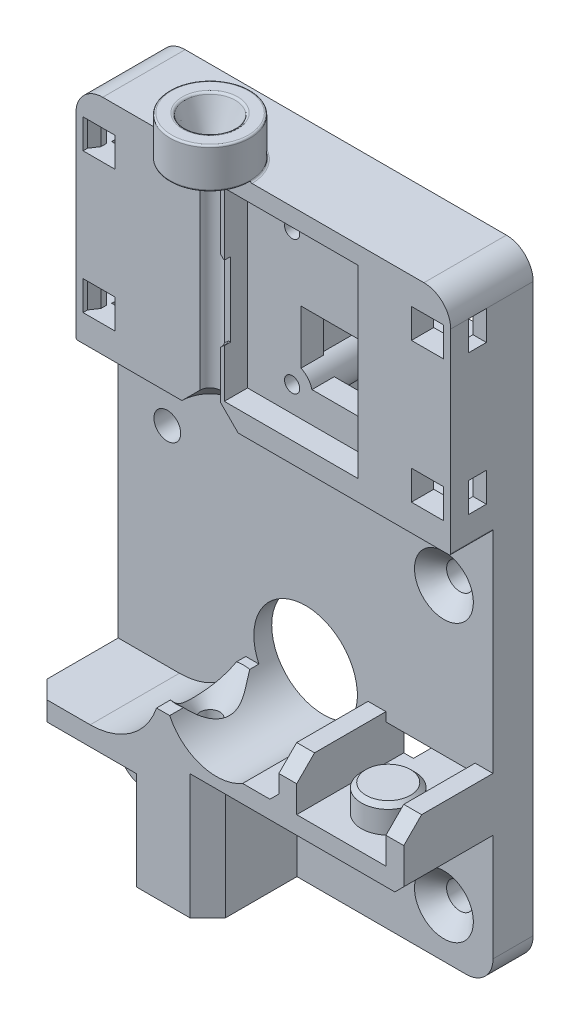
from build123d import *

# Parameters (mm, degrees)
SKETCH_26_R               = 5.8
SKETCH_26_R_2             = 1.5
EXTRUDE_8_DEPTH           = 4.5
EXTRUDE_9_DEPTH           = 10
SKETCH_29_R               = 11.25
CUT_EXTRUDE_1_DEPTH       = 2.5
CHAMFER_2_SIZE            = 0.8
CHAMFER_2_SIZE2           = 0.5
SKETCH_55_W               = 21.97
SKETCH_55_H               = 3
CUT_EXTRUDE_9_DEPTH       = 10
CHAMFER_3_SIZE            = 2
CHAMFER_START             = 4.5
CHAMFER_4_DEPTH           = 10.5
CHAMFER_START_2           = 4
CHAMFER_4_2_DEPTH         = 10.5
HOLE_WIZARD_M6_1_D        = 5
HOLE_WIZARD_M6_1_DEPTH    = 5.5
HOLE_WIZARD_1_D           = 3
HOLE_WIZARD_1_CSINK_D     = 6.6
HOLE_WIZARD_1_CSINK_ANGLE = 90
EXTRUDE_10_DEPTH          = 4.74
CUT_EXTRUDE_3_REACH       = 76.037
SKETCH_43_R               = 1.15
SKETCH_44_W               = 15
SKETCH_44_H               = 20.7
CUT_EXTRUDE_4_DEPTH       = 2.6
CUT_EXTRUDE_5_REACH       = 55.432
SKETCH_46_W               = 9
SKETCH_46_H               = 7.5
FILLET_4_R                = 0.2
CUT_EXTRUDE_8_REACH       = 56.804
SKETCH_53_W               = 10
SKETCH_53_H               = 4
SKETCH_54_R               = 3
CUT_EXTRUDE_10_DEPTH      = 2
SKETCH_56_W               = 1
SKETCH_56_H               = 8.3
CUT_EXTRUDE_11_DEPTH      = 0.7
SKETCH_45_R               = 2.3
EXTRUDE_13_DEPTH          = 6.64
CUT_EXTRUDE_12_REACH      = 56.804
SKETCH_57_R               = 0.85
SKETCH_61_R               = 2
CUT_EXTRUDE_13_DEPTH      = 10
CHAMFER_5_SIZE            = 0.5
FILLET_6_R                = 0.3
CHAMFER_6_SIZE            = 0.4
CHAMFER_8_SIZE            = 2
CUT_EXTRUDE_17_DEPTH      = 4.14
CUT_EXTRUDE_18_DEPTH      = 2.6
SKETCH_65_W               = 2
SKETCH_65_H               = 3.3
CUT_EXTRUDE_19_DEPTH      = 1.5
SKETCH_68_W               = 3
SKETCH_68_H               = 3.3
CUT_EXTRUDE_20_DEPTH      = 3
EXTRUDE_START             = 4.14
SKETCH_66_R               = 2.3
SKETCH_66_R_2             = 0.85
EXTRUDE_14_DEPTH          = 4.14
RIB_START                 = -6.6400001
RIB_1_DEPTH               = 6.6400001
RIB_START_2               = -8
RIB_1_2_OUTLINE_W         = 7.37
RIB_1_2_OUTLINE_H         = 1.5
RIB_1_2_OUTLINE_W_2       = 11.93
RIB_1_2_DEPTH             = 1.9155324
FILLET_7_R                = 0.2
FILLET_8_R                = 0.2
SKETCH_72_W               = 0.6
SKETCH_72_H               = 3.3
CUT_EXTRUDE_22_DEPTH      = 0.5
CUT_EXTRUDE_21_DEPTH      = 3.3
PATTERN_LINEAR_1_COUNT    = 2
PATTERN_LINEAR_1_PITCH    = 15.7


with BuildPart() as part:
    # 草图26 → 凸台-拉伸8 (new body)
    with BuildSketch(Plane.XY):
        with BuildLine():
            Line((-18, -21), (18, -21))
            ThreePointArc((18, -21), (20.121320344, -20.121320344), (21, -18))
            Line((21, -18), (21, 45.5))
            ThreePointArc((21, 45.5), (20.121320344, 47.621320344), (18, 48.5))
            Line((18, 48.5), (-18, 48.5))
            ThreePointArc((-18, 48.5), (-20.121320344, 47.621320344), (-21, 45.5))
            Line((-21, 45.5), (-21, -18))
            ThreePointArc((-21, -18), (-20.121320344, -20.121320344), (-18, -21))
        make_face()
        Circle(SKETCH_26_R, mode=Mode.SUBTRACT)
        with Locations((-15.5, 15.5)):
            Circle(SKETCH_26_R_2, mode=Mode.SUBTRACT)
        with Locations((15.5, 15.5)):
            Circle(SKETCH_26_R_2, mode=Mode.SUBTRACT)
        with Locations(Location((15.5, -15.5, 0), (0, 0, 180))):
            Circle(SKETCH_26_R_2, mode=Mode.SUBTRACT)
        with Locations(Location((-15.5, -15.5, 0), (0, 0, 180))):
            Circle(SKETCH_26_R_2, mode=Mode.SUBTRACT)
    extrude(amount=EXTRUDE_8_DEPTH)

    # 草图28 → 凸台-拉伸9 (add)
    with BuildSketch(Plane.XY.offset(4.5)):
        with BuildLine():
            Line((-21, -10), (-10.97, -10))
            Line((-10.97, -10), (-10.97, -21))
            Line((-10.97, -21), (-0.97, -21))
            Line((-0.97, -21), (-0.97, -10))
            Line((-0.97, -10), (21, -10))
            Line((21, -10), (21, 0))
            Line((21, 0), (19, 0))
            Line((19, 0), (19, -5))
            Line((19, -5), (9, -5))
            Line((9, -5), (9, 0))
            Line((9, 0), (7, 0))
            Line((7, 0), (7, -5))
            Line((7, -5), (2.939387691, -5))
            ThreePointArc((2.939387691, -5), (-1.696552439, -5.546323992), (-5.233545643, -2.5))
            Line((-5.233545643, -2.5), (-6.706454357, -2.5))
            ThreePointArc((-6.706454357, -2.5), (-9.56497696, -6.373019283), (-14.146753447, -7.849079599))
            Line((-14.146753447, -7.849079599), (-21, -7.849079599))
            Line((-21, -7.849079599), (-21, -10))
        make_face()
    extrude(amount=EXTRUDE_9_DEPTH)

    # 草图29 → 切除-拉伸1 (cut)
    with BuildSketch(Plane(origin=(0, 0, 0), x_dir=(-1, 0, 0), z_dir=(0, 0, -1))):
        Circle(SKETCH_29_R)
    extrude(amount=-CUT_EXTRUDE_1_DEPTH, mode=Mode.SUBTRACT)

    # 倒角2
    chamfer_2_edges = [part.edges().sort_by_distance(p)[0] for p in [
        (11.25, 0, 0),
    ]]
    chamfer_2_side = [part.faces().sort_by_distance(p)[0] for p in [
        (0, 16.106118952, 0),
    ]]
    chamfer(chamfer_2_edges, length=CHAMFER_2_SIZE, length2=CHAMFER_2_SIZE2, reference=chamfer_2_side[0])

    # 草图30 → 切除-旋转1 (revolve, cut)
    with BuildSketch(Plane.XY.offset(9.24)):
        Polygon((-5.97, -2.5), (-2.190437378, -2.5), (-4.87, -5.693378381), (-4.87, -22.266274107), (-5.97, -22.266274107), align=None)
    revolve(axis=Axis((-5.97, -25.234849808, 9.24), (0, 1, 0)), mode=Mode.SUBTRACT)

    # 草图34 → 旋转1 (revolve)
    with BuildSketch(Plane.XY.offset(9.24)):
        Polygon((16.5, -2), (17, -2.5), (17, -5), (14, -5), (14, -2), align=None)
    revolve(axis=Axis((14, -23.38223113, 9.24), (0, 1, 0)))

    # 草图55 → 切除-拉伸9 (cut)
    with BuildSketch(Plane.XY.offset(14.5)):
        with Locations((10.015, -8.5)):
            Rectangle(SKETCH_55_W, SKETCH_55_H)
    extrude(amount=-CUT_EXTRUDE_9_DEPTH, mode=Mode.SUBTRACT)

    # 倒角3
    chamfer_3_edges = [part.edges().sort_by_distance(p)[0] for p in [
        (20, 0, 14.5),
        (8, 0, 14.5),
        (-0.97, -14, 14.5),
        (-10.97, -15.5, 14.5),
        (-21, -8.9245398, 14.5),
    ]]
    chamfer(chamfer_3_edges, length=CHAMFER_3_SIZE)

    # 倒角4: read off the stored shape, not the designer's step
    # 倒角4 outline → 倒角4 (cut)
    with BuildSketch(Plane.XY.offset(CHAMFER_START)):
        Polygon((21, -7), (21, -6), (20, -7), align=None)
    extrude(amount=CHAMFER_4_DEPTH, mode=Mode.SUBTRACT)

    # Chamfer 4 2 outline → Chamfer 4 2 (add)
    with BuildSketch(Plane.XY.offset(CHAMFER_START_2)):
        Polygon((7, -5), (7, -4), (6, -5), align=None)
    extrude(amount=CHAMFER_4_2_DEPTH)

    # M6 螺纹孔1
    with Locations(Plane(origin=(0, -21, 0), x_dir=(-1, 0, 0), z_dir=(0, -1, 0))):
        with Locations((5.97, -9.24)):
            Hole(HOLE_WIZARD_M6_1_D / 2, depth=HOLE_WIZARD_M6_1_DEPTH)

    # 打孔尺寸(%根据十字)槽沉头木螺钉的类型1 (through all)
    with Locations(Plane.XY.offset(4.5)):
        with Locations((15.5, 15.5), (-15.5, -15.5), (15.5, -15.5)):
            CounterSinkHole(HOLE_WIZARD_1_D / 2, HOLE_WIZARD_1_CSINK_D / 2, counter_sink_angle=HOLE_WIZARD_1_CSINK_ANGLE)

    # 草图42 → 凸台-拉伸10 (add)
    with BuildSketch(Plane.XY.offset(4.5)):
        with BuildLine():
            Line((-21, 23.5), (21, 23.5))
            Line((21, 23.5), (21, 45.5))
            ThreePointArc((21, 45.5), (20.121320344, 47.621320344), (18, 48.5))
            Line((18, 48.5), (-18, 48.5))
            ThreePointArc((-18, 48.5), (-20.121320344, 47.621320344), (-21, 45.5))
            Line((-21, 45.5), (-21, 23.5))
        make_face()
    extrude(amount=EXTRUDE_10_DEPTH)

    # 草图43 → 切除-拉伸3 (cut, up to next)
    with BuildSketch(Plane(origin=(0, 48.5, 0), x_dir=(1, 0, 0), z_dir=(0, 1, 0)), mode=Mode.PRIVATE) as cut_extrude_3_sk1:
        with Locations((-5.97, -9.24)):
            Circle(SKETCH_43_R)
    cut_extrude_3_tool1 = extrude(cut_extrude_3_sk1.sketch, amount=-CUT_EXTRUDE_3_REACH, mode=Mode.PRIVATE) & part.part
    add(cut_extrude_3_tool1.solids().sort_by_distance((-5.97, 48.5, 9.24))[0], mode=Mode.SUBTRACT)

    # 草图44 → 切除-拉伸4 (cut)
    with BuildSketch(Plane.XY.offset(9.24)):
        with Locations((3.13, 36.15)):
            Rectangle(SKETCH_44_W, SKETCH_44_H)
    extrude(amount=-CUT_EXTRUDE_4_DEPTH, mode=Mode.SUBTRACT)

    # 草图46 → 切除-拉伸5 (cut, up to next)
    with BuildSketch(Plane.XY.offset(6.64), mode=Mode.PRIVATE) as cut_extrude_5_sk1:
        with Locations((6.13, 33)):
            Rectangle(SKETCH_46_W, SKETCH_46_H)
    cut_extrude_5_tool1 = extrude(cut_extrude_5_sk1.sketch, amount=-CUT_EXTRUDE_5_REACH, mode=Mode.PRIVATE) & part.part
    add(cut_extrude_5_tool1.solids().sort_by_distance((6.13, 33, 6.64))[0], mode=Mode.SUBTRACT)

    # 圆角4
    fillet_4_edges = [part.edges().sort_by_distance(p)[0] for p in [
        (-21, 23.5, 6.87),
        (21, 23.5, 6.87),
    ]]
    fillet(fillet_4_edges, radius=FILLET_4_R)

    # 草图53 → 切除-拉伸8 (cut, up to next)
    with BuildSketch(Plane(origin=(0, 0, 0), x_dir=(-1, 0, 0), z_dir=(0, 0, -1)), mode=Mode.PRIVATE) as cut_extrude_8_sk1:
        with Locations((-14, -3)):
            Rectangle(SKETCH_53_W, SKETCH_53_H)
    cut_extrude_8_tool1 = extrude(cut_extrude_8_sk1.sketch, amount=-CUT_EXTRUDE_8_REACH, mode=Mode.PRIVATE) & part.part
    add(cut_extrude_8_tool1.solids().sort_by_distance((14, -3, 0))[0], mode=Mode.SUBTRACT)

    # 草图54 → 切除-拉伸10 (cut)
    # profile 1 of 4: a face of its own
    with BuildSketch(Plane(origin=(0, 0, 0), x_dir=(-1, 0, 0), z_dir=(0, 0, -1))):
        with BuildLine():
            Line((-18.5, -19.5), (-0.75, -19.5))
            Line((-0.75, -19.5), (-0.75, -13.228756555))
            ThreePointArc((-0.75, -13.228756555), (-7.008393533, -11.244773012), (-11.546103239, -6.5))
            Line((-11.546103239, -6.5), (-19.5, -6.5))
            Line((-19.5, -6.5), (-19.5, -18.5))
            ThreePointArc((-19.5, -18.5), (-19.207106781, -19.207106781), (-18.5, -19.5))
        make_face()
        with Locations((-15.5, -15.5)):
            Circle(SKETCH_54_R, mode=Mode.SUBTRACT)
    # profile 2 of 4: a face of its own
    with BuildSketch(Plane(origin=(0, 0, 0), x_dir=(-1, 0, 0), z_dir=(0, 0, -1))):
        with BuildLine():
            Line((19.5, -18.5), (19.5, -0.75))
            Line((19.5, -0.75), (13.228756555, -0.75))
            ThreePointArc((13.228756555, -0.75), (9.369164851, -9.369164851), (0.75, -13.228756555))
            Line((0.75, -13.228756555), (0.75, -19.5))
            Line((0.75, -19.5), (18.5, -19.5))
            ThreePointArc((18.5, -19.5), (19.207106781, -19.207106781), (19.5, -18.5))
        make_face()
        with Locations((15.5, -15.5)):
            Circle(SKETCH_54_R, mode=Mode.SUBTRACT)
    # profile 3 of 4: a face of its own
    with BuildSketch(Plane(origin=(0, 0, 0), x_dir=(-1, 0, 0), z_dir=(0, 0, -1))):
        with BuildLine():
            Line((19.5, 23.5), (0.75, 23.5))
            Line((0.75, 23.5), (0.75, 13.228756555))
            ThreePointArc((0.75, 13.228756555), (9.369164851, 9.369164851), (13.228756555, 0.75))
            Line((13.228756555, 0.75), (19.5, 0.75))
            Line((19.5, 0.75), (19.5, 23.5))
        make_face()
        with Locations((15.5, 15.5)):
            Circle(SKETCH_54_R, mode=Mode.SUBTRACT)
    # profile 4 of 4: a face of its own
    with BuildSketch(Plane(origin=(0, 0, 0), x_dir=(-1, 0, 0), z_dir=(0, 0, -1))):
        with BuildLine():
            Line((-19.5, 23.5), (-19.5, 0.5))
            Line((-19.5, 0.5), (-13.240562677, 0.5))
            ThreePointArc((-13.240562677, 0.5), (-9.457233838, 9.280260133), (-0.75, 13.228756555))
            Line((-0.75, 13.228756555), (-0.75, 23.5))
            Line((-0.75, 23.5), (-19.5, 23.5))
        make_face()
        with Locations((-15.5, 15.5)):
            Circle(SKETCH_54_R, mode=Mode.SUBTRACT)
    extrude(amount=-CUT_EXTRUDE_10_DEPTH, mode=Mode.SUBTRACT)

    # 草图56 → 切除-拉伸11 (cut)
    with BuildSketch(Plane.XY.offset(9.24)):
        with Locations((-4.87, 35.35)):
            Rectangle(SKETCH_56_W, SKETCH_56_H)
    extrude(amount=-CUT_EXTRUDE_11_DEPTH, mode=Mode.SUBTRACT)

    # 草图45 → 凸台-拉伸13 (add)
    with BuildSketch(Plane.XY.offset(6.64)):
        with Locations((0.63, 28.65)):
            Circle(SKETCH_45_R)
        with Locations((0.63, 43.65)):
            Circle(SKETCH_45_R)
    extrude(amount=-EXTRUDE_13_DEPTH)

    # 草图57 → 切除-拉伸12 (cut, up to next)
    with BuildSketch(Plane(origin=(0, 0, 0), x_dir=(-1, 0, 0), z_dir=(0, 0, -1)), mode=Mode.PRIVATE) as cut_extrude_12_sk1:
        with Locations((-0.63, 43.65)):
            Circle(SKETCH_57_R)
    cut_extrude_12_tool1 = extrude(cut_extrude_12_sk1.sketch, amount=-CUT_EXTRUDE_12_REACH, mode=Mode.PRIVATE) & part.part
    # 草图57 → 切除-拉伸12 (cut, up to next)
    with BuildSketch(Plane(origin=(0, 0, 0), x_dir=(-1, 0, 0), z_dir=(0, 0, -1)), mode=Mode.PRIVATE) as cut_extrude_12_sk2:
        with Locations((-0.63, 28.65)):
            Circle(SKETCH_57_R)
    cut_extrude_12_tool2 = extrude(cut_extrude_12_sk2.sketch, amount=-CUT_EXTRUDE_12_REACH, mode=Mode.PRIVATE) & part.part
    add(cut_extrude_12_tool1.solids().sort_by_distance((0.63, 43.65, 0))[0], mode=Mode.SUBTRACT)
    add(cut_extrude_12_tool2.solids().sort_by_distance((0.63, 28.65, 0))[0], mode=Mode.SUBTRACT)

    # 草图61 → 切除-拉伸13 (cut)
    with BuildSketch(Plane.XZ.offset(21)):
        with Locations((-5.97, 9.24)):
            Circle(SKETCH_61_R)
    extrude(amount=-CUT_EXTRUDE_13_DEPTH, mode=Mode.SUBTRACT)

    # 草图50 → 旋转2 (revolve)
    with BuildSketch(Plane(origin=(0, 37.76, 9.24), x_dir=(1, 0, 0), z_dir=(0, 0, -1)), mode=Mode.PRIVATE) as revolve_2_sk:
        Polygon((-4.82, -10.74), (-1.47, -10.74), (-1.47, -15.24), (-3.07, -15.24), align=None)
    revolve(revolve_2_sk.sketch.rotate(Axis((-5.97, 53.12412622, 9.24), (0, -1, 0)), 90), axis=Axis((-5.97, 53.12412622, 9.24), (0, -1, 0)))

    # 倒角5
    chamfer_5_edges = [part.edges().sort_by_distance(p)[0] for p in [
        (-7.97, -15.5, 9.24),
    ]]
    chamfer(chamfer_5_edges, length=CHAMFER_5_SIZE - 0.0001)  # a hair under: the kernel refuses the full size

    # 圆角6
    fillet_6_edges = [part.edges().sort_by_distance(p)[0] for p in [
        (-5.97, 53, 6.34),
    ]]
    fillet(fillet_6_edges, radius=FILLET_6_R)

    # 倒角6
    chamfer_6_edges = [part.edges().sort_by_distance(p)[0] for p in [
        (-4.881015028, 31.2, 8.870389757),
        (-4.881015028, 39.5, 8.870389757),
    ]]
    chamfer(chamfer_6_edges, length=CHAMFER_6_SIZE)

    # 倒角8
    chamfer_8_edges = [part.edges().sort_by_distance(p)[0] for p in [
        (-5.97, 23.5, 8.09),
    ]]
    chamfer(chamfer_8_edges, length=CHAMFER_8_SIZE)

    # 草图63 → 切除-拉伸17 (cut)
    with BuildSketch(Plane(origin=(0, 0, 0), x_dir=(-1, 0, 0), z_dir=(0, 0, -1))):
        with BuildLine():
            Line((19.5, 25), (19.5, 45.5))
            ThreePointArc((19.5, 45.5), (19.060660172, 46.560660172), (18, 47))
            Line((18, 47), (-18, 47))
            ThreePointArc((-18, 47), (-19.060660172, 46.560660172), (-19.5, 45.5))
            Line((-19.5, 45.5), (-19.5, 25))
            Line((-19.5, 25), (19.5, 25))
        make_face()
    extrude(amount=-CUT_EXTRUDE_17_DEPTH, mode=Mode.SUBTRACT)

    # 草图64 → 切除-拉伸18 (cut)
    with BuildSketch(Plane(origin=(0, 0, 4.14), x_dir=(-1, 0, 0), z_dir=(0, 0, -1))):
        with BuildLine():
            Line((-19.5, 25), (-12.13, 25))
            Line((-12.13, 25), (-12.13, 47))
            Line((-12.13, 47), (-18, 47))
            ThreePointArc((-18, 47), (-19.060660172, 46.560660172), (-19.5, 45.5))
            Line((-19.5, 45.5), (-19.5, 25))
        make_face()
        with BuildLine():
            Line((7.57, 47), (7.57, 25))
            Line((7.57, 25), (19.5, 25))
            Line((19.5, 25), (19.5, 45.5))
            ThreePointArc((19.5, 45.5), (19.060660172, 46.560660172), (18, 47))
            Line((18, 47), (7.57, 47))
        make_face()
    extrude(amount=-CUT_EXTRUDE_18_DEPTH, mode=Mode.SUBTRACT)

    # 草图65 → 切除-拉伸19 (cut)
    with BuildSketch(Plane(origin=(-21, 0, 27.74), x_dir=(0, 0, -1), z_dir=(1, 0, 0))):
        with Locations((21.5, 43.85)):
            Rectangle(SKETCH_65_W, SKETCH_65_H)
        with Locations((21.5, 28.15)):
            Rectangle(SKETCH_65_W, SKETCH_65_H)
    cut_extrude_19 = extrude(amount=CUT_EXTRUDE_19_DEPTH, mode=Mode.SUBTRACT)

    # 镜向1: 切除-拉伸19 across plane
    add(cut_extrude_19.mirror(Plane(origin=(0, 0, 0), x_dir=(0, 0, 1), z_dir=(1, 0, 0))), mode=Mode.SUBTRACT)

    # 草图68 → 切除-拉伸20 (cut)
    with BuildSketch(Plane(origin=(0, 0, 9.24), x_dir=(-1, 0, 0), z_dir=(0, 0, -1))):
        with Locations((18.1, 28.15)):
            Rectangle(SKETCH_68_W, SKETCH_68_H)
        with Locations((18.1, 43.85)):
            Rectangle(SKETCH_68_W, SKETCH_68_H)
        with Locations((-18.1, 43.85)):
            Rectangle(SKETCH_68_W, SKETCH_68_H)
        with Locations((-18.1, 28.15)):
            Rectangle(SKETCH_68_W, SKETCH_68_H)
    extrude(amount=CUT_EXTRUDE_20_DEPTH, mode=Mode.SUBTRACT)

    # 草图66 → 凸台-拉伸14 (add)
    # profile 1 of 2: a face of its own
    with BuildSketch(Plane(origin=(0, 0, 4.14), x_dir=(-1, 0, 0), z_dir=(0, 0, -1)).offset(EXTRUDE_START)):
        with Locations(Location((-0.63, 43.65, 0), (0, 0, 180))):
            Circle(SKETCH_66_R)
        with Locations((-0.63, 43.65)):
            Circle(SKETCH_66_R_2, mode=Mode.SUBTRACT)
    # profile 2 of 2: a face of its own
    with BuildSketch(Plane(origin=(0, 0, 4.14), x_dir=(-1, 0, 0), z_dir=(0, 0, -1)).offset(EXTRUDE_START)):
        with Locations(Location((-0.63, 28.65, 0), (0, 0, 180))):
            Circle(SKETCH_66_R)
        with Locations((-0.63, 28.65)):
            Circle(SKETCH_66_R_2, mode=Mode.SUBTRACT)
    extrude(amount=-EXTRUDE_14_DEPTH)

    # 筋1: read off the stored shape, not the designer's step
    # 筋1 outline → 筋1 (add)
    with BuildSketch(Plane(origin=(0, 0, 0), x_dir=(-1, 0, 0), z_dir=(0, 0, -1)).offset(RIB_START)):
        with BuildLine():
            Line((-1.38, 36.75), (-1.38, 30.824281491))
            ThreePointArc((-1.38, 30.824281491), (-0.63, 30.95), (0.12, 30.824281491))
            Line((0.12, 30.824281491), (0.12, 36.75))
            Line((0.12, 36.75), (19.5, 36.75))
            Line((19.5, 36.75), (19.5, 38.25))
            Line((19.5, 38.25), (0.12, 38.25))
            Line((0.12, 38.25), (0.12, 41.475718509))
            ThreePointArc((0.12, 41.475718509), (-0.63, 41.35), (-1.38, 41.475718509))
            Line((-1.38, 41.475718509), (-1.38, 38.25))
            Line((-1.38, 38.25), (-19.5, 38.25))
            Line((-19.5, 38.25), (-19.5, 36.75))
            Line((-19.5, 36.75), (-1.38, 36.75))
        make_face()
        with BuildLine():
            ThreePointArc((0.12, 26.475718509), (-0.63, 26.35), (-1.38, 26.475718509))
            Line((-1.38, 26.475718509), (-1.38, 25))
            Line((-1.38, 25), (0.12, 25))
            Line((0.12, 25), (0.12, 26.475718509))
        make_face()
        with BuildLine():
            Line((0.12, 47), (-1.38, 47))
            Line((-1.38, 47), (-1.38, 45.824281491))
            ThreePointArc((-1.38, 45.824281491), (-0.63, 45.95), (0.12, 45.824281491))
            Line((0.12, 45.824281491), (0.12, 47))
        make_face()
    extrude(amount=RIB_1_DEPTH)

    # Rib 1 2 outline → Rib 1 2 (add)
    with BuildSketch(Plane(origin=(0, 0, 0), x_dir=(-1, 0, 0), z_dir=(0, 0, -1)).offset(RIB_START_2)):
        with Locations((-15.815, 37.5)):
            Rectangle(RIB_1_2_OUTLINE_W, RIB_1_2_OUTLINE_H)
        with Locations((13.535, 37.5)):
            Rectangle(RIB_1_2_OUTLINE_W_2, RIB_1_2_OUTLINE_H)
    extrude(amount=RIB_1_2_DEPTH)

    # 圆角7
    # the kernel refuses this fillet: 0.2 mm, written as the material it takes off along each edge
    with BuildSketch(Plane(origin=(-5.97, 53, 9.24), x_dir=(0, 0, 1), z_dir=(1, 0, 0))) as fillet_7_piece_1:
        with BuildLine():
            CenterArc((4.5 - FILLET_7_R, FILLET_7_R), FILLET_7_R, 270, 90)
            Line((4.5 - FILLET_7_R, 0), (4.5, 0))
            Line((4.5, 0), (4.5, FILLET_7_R))
        make_face()
    revolve(axis=Axis((-5.97, 53, 9.24), (0, -1, 0)), mode=Mode.SUBTRACT)
    with BuildSketch(Plane(origin=(-5.97, 48.5, 9.24), x_dir=(1, 0, 0), z_dir=(0, 0, -1))) as fillet_7_piece_2:
        with BuildLine():
            CenterArc((4.5 - FILLET_7_R, -FILLET_7_R), FILLET_7_R, 0, 90)
            Line((4.5 - FILLET_7_R, 0), (4.5, 0))
            Line((4.5, 0), (4.5, -FILLET_7_R))
        make_face()
    revolve(axis=Axis((-5.97, 48.5, 9.24), (0, -1, 0)), revolution_arc=90, mode=Mode.SUBTRACT)
    with BuildSketch(Plane(origin=(-5.97, 48.5, 9.24), x_dir=(0, 0, 1), z_dir=(1, 0, 0))) as fillet_7_piece_3:
        with BuildLine():
            CenterArc((4.5 - FILLET_7_R, -FILLET_7_R), FILLET_7_R, 0, 90)
            Line((4.5 - FILLET_7_R, 0), (4.5, 0))
            Line((4.5, 0), (4.5, -FILLET_7_R))
        make_face()
    revolve(axis=Axis((-5.97, 48.5, 9.24), (0, -1, 0)), revolution_arc=90, mode=Mode.SUBTRACT)

    # 圆角8
    fillet_8_edges = [part.edges().sort_by_distance(p)[0] for p in [
        (-5.97, 48.5, 4.74),
    ]]
    fillet(fillet_8_edges, radius=FILLET_8_R)

    # 草图72 → 切除-拉伸22 (cut)
    with BuildSketch(Plane.XY.offset(9.24)):
        with Locations((-19.9, 28.15)):
            Rectangle(SKETCH_72_W, SKETCH_72_H)
        with Locations((-19.9, 43.85)):
            Rectangle(SKETCH_72_W, SKETCH_72_H)
        with Locations((19.9, 43.85)):
            Rectangle(SKETCH_72_W, SKETCH_72_H)
        with Locations((19.9, 28.15)):
            Rectangle(SKETCH_72_W, SKETCH_72_H)
    extrude(amount=-CUT_EXTRUDE_22_DEPTH, mode=Mode.SUBTRACT)

    # 草图69 → 切除-拉伸21 (cut)
    with BuildSketch(Plane(origin=(0, 26.5, 0), x_dir=(1, 0, 0), z_dir=(0, 1, 0))):
        Polygon((-19.6, -7.84), (-19.6, -8.74), (-20.2, -8.74), align=None)
        Polygon((19.6, -7.84), (19.6, -8.74), (20.2, -8.74), align=None)
    cut_extrude_21 = extrude(amount=CUT_EXTRUDE_21_DEPTH, mode=Mode.SUBTRACT)

    # 阵列(线性)1: 切除-拉伸21 ×2
    with Locations(*[(0, i * PATTERN_LINEAR_1_PITCH, 0) for i in range(1, PATTERN_LINEAR_1_COUNT)]):
        add(cut_extrude_21, mode=Mode.SUBTRACT)


solid = part.part
